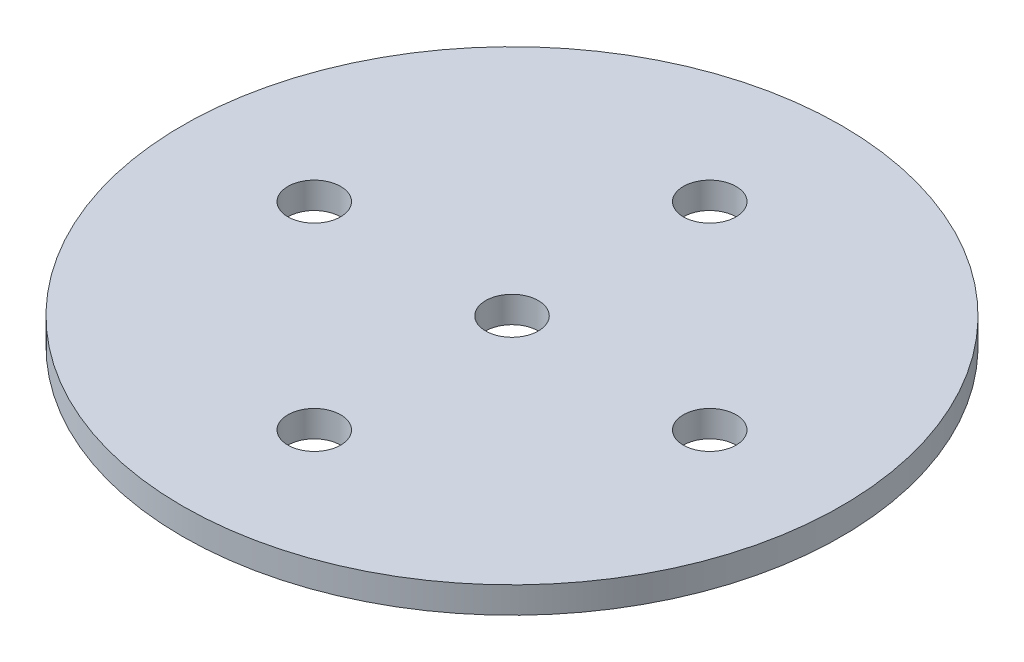
from build123d import *

# Parameters (mm, degrees)
SKETCH1_R           = 125
SKETCH1_R_2         = 10
BOSS_EXTRUDE1_DEPTH = 10


with BuildPart() as part:
    # Sketch1 → Boss-Extrude1 (new body)
    with BuildSketch(Plane(origin=(0, 0, 0), x_dir=(1, 0, 0), z_dir=(0, 1, 0))):
        Circle(SKETCH1_R)
        Circle(SKETCH1_R_2, mode=Mode.SUBTRACT)
        with Locations((75, 0)):
            Circle(SKETCH1_R_2, mode=Mode.SUBTRACT)
        with Locations((0, -75)):
            Circle(SKETCH1_R_2, mode=Mode.SUBTRACT)
        with Locations((-75, 0)):
            Circle(SKETCH1_R_2, mode=Mode.SUBTRACT)
        with Locations((0, 75)):
            Circle(SKETCH1_R_2, mode=Mode.SUBTRACT)
    extrude(amount=BOSS_EXTRUDE1_DEPTH)


solid = part.part
